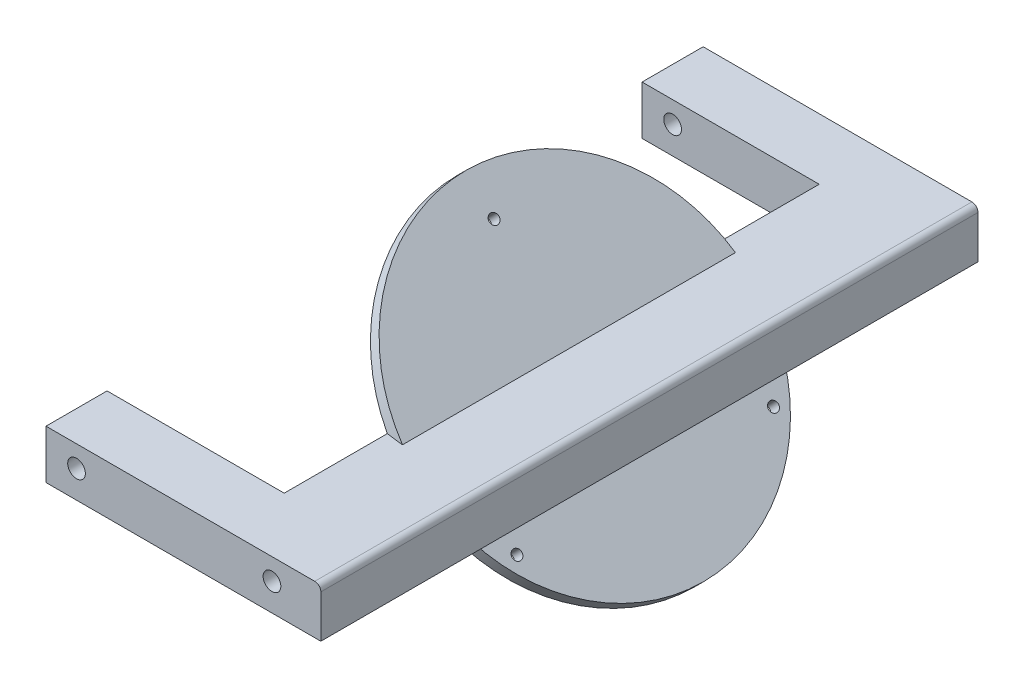
from build123d import *

# Parameters (mm, degrees)
BASE_DEPTH             = 53.8
SKETCH4_R              = 27.5
BOSS_EXTRUDE2_DEPTH    = 2
M2X0_4_TAPPED_HOLE1_D  = 1.6
FILLET1_R              = 0.5
SIDE_HOLES_D           = 2.9
SIDE_ARM_DEPTH         = 10
M2_5_CLEARANCE_HOLE1_D = 2.9
FILLET2_R              = 1


with BuildPart() as part:
    # Sketch1 → Base (new, symmetric)
    with BuildSketch(Plane.XY):
        Polygon((8, 4), (-8, 4), (0, -4), (8, -4), align=None)
    extrude(amount=BASE_DEPTH, both=True)

    # Sketch4 → Boss-Extrude2 (add)
    with BuildSketch(Plane(origin=(-2, -2, 0), x_dir=(0, 0, 1), z_dir=(-0.7071067811865475, -0.7071067811865476, 0))):
        with Locations((0, 2.828427125)):
            Circle(SKETCH4_R)
    extrude(amount=-BOSS_EXTRUDE2_DEPTH)

    # M2x0.4 Tapped Hole1 (through all)
    with Locations(Plane(origin=(-0.585786438, -0.585786438, 0), x_dir=(0.7071067811865475, -0.7071067811865477, 0), z_dir=(0.7071067811865477, 0.7071067811865475, 0))):
        with Locations((-23.828427125, 0), (11.171572875, 21), (11.171572875, -21)):
            Hole(M2X0_4_TAPPED_HOLE1_D / 2)

    # Sketch8 → Revolve1 (revolve)
    with BuildSketch(Plane(origin=(-2, 2, 0), x_dir=(0, 0, 1), z_dir=(0.7071067811865437, -0.7071067811865515, 0))):
        with BuildLine():
            Line((0, 3.828427125), (0, 2.828427125))
            Line((0, 2.828427125), (-12, 2.828427125))
            Line((-12, 2.828427125), (-6.5, 10.328427125))
            ThreePointArc((-6.5, 10.328427125), (-4.596194078, 5.732233047), (0, 3.828427125))
        make_face()
    revolve(axis=Axis((-4, 0, 0), (-0.7071067811865515, -0.7071067811865437, 0)))

    # Fillet1
    fillet1_edges = [part.edges().sort_by_distance(p)[0] for p in [
        (-9.303300859, -5.303300859, 6.5),
    ]]
    fillet(fillet1_edges, radius=FILLET1_R)

    # Side Holes (through all)
    with Locations(Plane.XY.offset(53.8)):
        with Locations((0, 0.5)):
            Hole(SIDE_HOLES_D / 2)

    # Sketch9 → Side Arm (add)
    with BuildSketch(Plane.XY.offset(53.8)):
        Polygon((-8, 4), (0, -4), (-37, -4), (-37, 4), align=None)
    side_arm = extrude(amount=-SIDE_ARM_DEPTH)

    # Mirror1: Side Arm across plane
    add(side_arm.mirror(Plane.XY))

    # M2.5 Clearance Hole1 (through all)
    with Locations(Plane.XY.offset(53.8)):
        with Locations((-32, 0.5)):
            Hole(M2_5_CLEARANCE_HOLE1_D / 2)

    # Fillet2
    fillet2_edges = [part.edges().sort_by_distance(p)[0] for p in [
        (8, 4, 0),
    ]]
    fillet(fillet2_edges, radius=FILLET2_R)


solid = part.part
